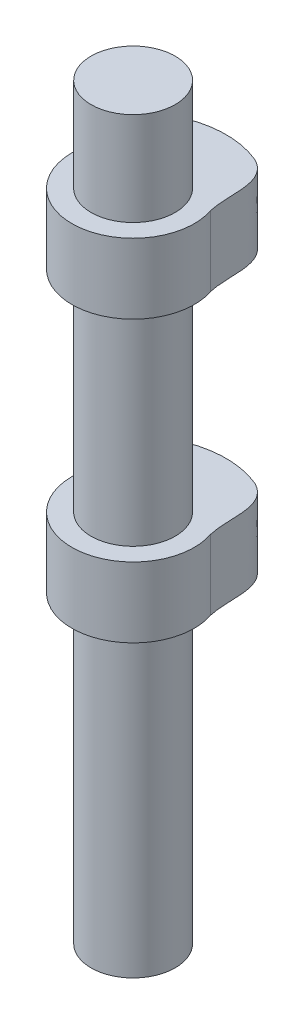
from build123d import *

# Parameters (mm, degrees)
SKETCH1_R           = 25.273
BOSS_EXTRUDE1_DEPTH = 203.2
CUT_EXTRUDE1_START  = -203.2
CUT_EXTRUDE1_DEPTH  = 203.2
SKETCH3_OUTSIDE_W   = 77.326
SKETCH3_OUTSIDE_H   = 85.949
SKETCH3_OUTSIDE_R   = 16.6497
CUT_EXTRUDE5_DEPTH  = 50.8
SKETCH4_OUTSIDE_W   = 77.326
SKETCH4_OUTSIDE_H   = 85.949
SKETCH4_OUTSIDE_R   = 16.6497
CUT_EXTRUDE6_DEPTH  = 57.15
SKETCH5_OUTSIDE_W   = 77.326
SKETCH5_OUTSIDE_H   = 85.949
SKETCH5_OUTSIDE_R   = 11.43
CUT_EXTRUDE10_DEPTH = 82.55
SKETCH7_OUTSIDE_W   = 77.326
SKETCH7_OUTSIDE_H   = 85.949
SKETCH7_OUTSIDE_R   = 11.43
CUT_EXTRUDE11_DEPTH = 57.15
SKETCH8_OUTSIDE_W   = 77.326
SKETCH8_OUTSIDE_H   = 85.949
SKETCH8_OUTSIDE_R   = 11.43
CUT_EXTRUDE12_DEPTH = 25.4


with BuildPart() as part:
    # Sketch1 → Boss-Extrude1 (new body)
    with BuildSketch(Plane(origin=(0, 0, 0), x_dir=(1, 0, 0), z_dir=(0, 1, 0))):
        Circle(SKETCH1_R)
    extrude(amount=BOSS_EXTRUDE1_DEPTH)

    # Sketch2 → Cut-Extrude1 (cut)
    with BuildSketch(Plane(origin=(0, 203.2, 0), x_dir=(1, 0, 0), z_dir=(0, 1, 0)).offset(CUT_EXTRUDE1_START)):
        with BuildLine():
            ThreePointArc((16.131428812, 4.121833886), (16.519624093, 2.077144651), (16.6497, 0))
            ThreePointArc((16.6497, 0), (-2.077144651, -16.519624093), (-16.131428812, 4.121833886))
            ThreePointArc((-16.131428812, 4.121833886), (-15.535644224, 5.988010406), (-14.724792916, 7.771292277))
            add(Edge.make_bspline(
                [(-14.724792916, 7.771292277), (-13.993112244, 11.833627294), (-14.951269099, 19.976611229), (-9.134694512, 23.553200783), (-6.765592548, 24.350591091)],
                knots=[0.117816193, 0.117816193, 0.117816193, 0.117816193, 0.459844437, 0.648405496, 0.648405496, 0.648405496, 0.648405496], degree=3))
            ThreePointArc((-6.765592548, 24.350591091), (-15.292771308, -20.121025688), (25.273, 0))
            ThreePointArc((25.273, 0), (21.007635157, 14.050046053), (9.651285593, 23.357594384))
            add(Edge.make_bspline(
                [(15.783143796, 5.301403776), (14.234187932, 11.657324188), (17.010518971, 19.800729125), (9.651285593, 23.357594384)],
                knots=[0.052591674, 0.052591674, 0.052591674, 0.052591674, 0.886528555, 0.886528555, 0.886528555, 0.886528555], degree=3))
            ThreePointArc((15.783143796, 5.301403776), (15.968181877, 4.714835907), (16.131428812, 4.121833886))
        make_face()
    extrude(amount=CUT_EXTRUDE1_DEPTH, mode=Mode.SUBTRACT)

    # Sketch3 outside → Cut-Extrude5 (cut)
    with BuildSketch(Plane(origin=(0, 177.8, 0), x_dir=(1, 0, 0), z_dir=(0, 1, 0))):
        with Locations((0, 4.3115)):
            Rectangle(SKETCH3_OUTSIDE_W, SKETCH3_OUTSIDE_H)
        Circle(SKETCH3_OUTSIDE_R, mode=Mode.SUBTRACT)
    extrude(amount=CUT_EXTRUDE5_DEPTH, mode=Mode.SUBTRACT)

    # Sketch4 outside → Cut-Extrude6 (cut)
    with BuildSketch(Plane(origin=(0, 101.6, 0), x_dir=(1, 0, 0), z_dir=(0, 1, 0))):
        with Locations((0, 4.3115)):
            Rectangle(SKETCH4_OUTSIDE_W, SKETCH4_OUTSIDE_H)
        Circle(SKETCH4_OUTSIDE_R, mode=Mode.SUBTRACT)
    extrude(amount=CUT_EXTRUDE6_DEPTH, mode=Mode.SUBTRACT)

    # Sketch5 outside → Cut-Extrude10 (cut)
    with BuildSketch(Plane(origin=(0, 0, 0), x_dir=(-1, 0, 0), z_dir=(0, -1, 0))):
        with Locations((0, 4.3115)):
            Rectangle(SKETCH5_OUTSIDE_W, SKETCH5_OUTSIDE_H)
        Circle(SKETCH5_OUTSIDE_R, mode=Mode.SUBTRACT)
    extrude(amount=-CUT_EXTRUDE10_DEPTH, mode=Mode.SUBTRACT)

    # Sketch7 outside → Cut-Extrude11 (cut)
    with BuildSketch(Plane(origin=(0, 101.6, 0), x_dir=(1, 0, 0), z_dir=(0, 1, 0))):
        with Locations((0, 4.3115)):
            Rectangle(SKETCH7_OUTSIDE_W, SKETCH7_OUTSIDE_H)
        Circle(SKETCH7_OUTSIDE_R, mode=Mode.SUBTRACT)
    extrude(amount=CUT_EXTRUDE11_DEPTH, mode=Mode.SUBTRACT)

    # Sketch8 outside → Cut-Extrude12 (cut)
    with BuildSketch(Plane(origin=(0, 177.8, 0), x_dir=(1, 0, 0), z_dir=(0, 1, 0))):
        with Locations((0, 4.3115)):
            Rectangle(SKETCH8_OUTSIDE_W, SKETCH8_OUTSIDE_H)
        Circle(SKETCH8_OUTSIDE_R, mode=Mode.SUBTRACT)
    extrude(amount=CUT_EXTRUDE12_DEPTH, mode=Mode.SUBTRACT)


solid = part.part
